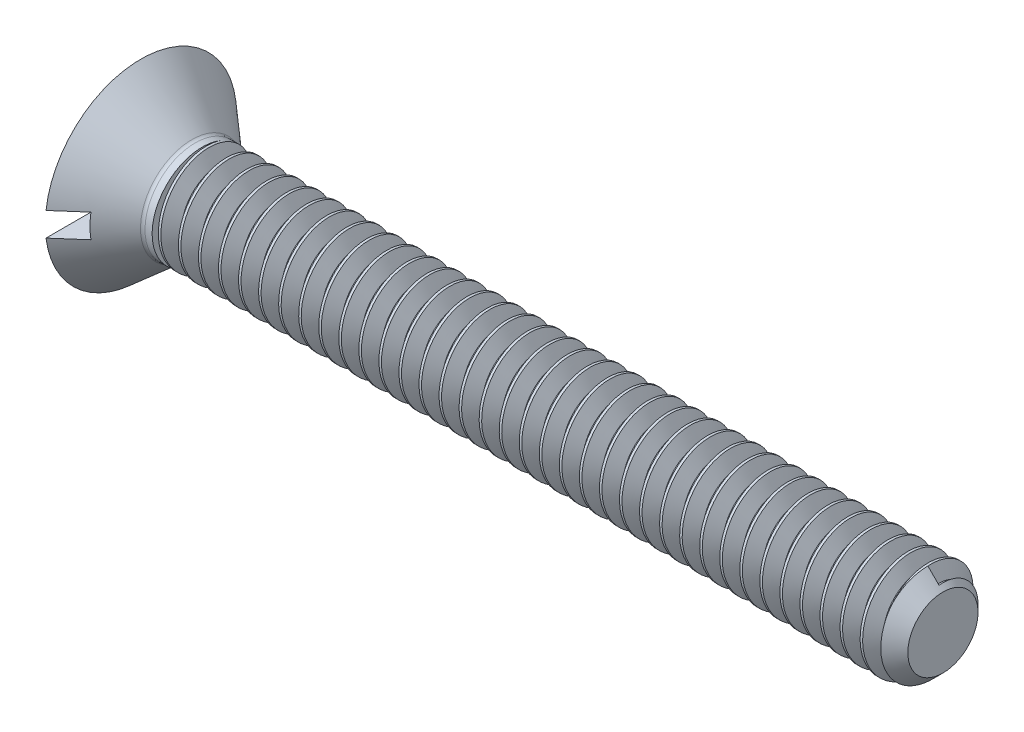
from build123d import *

# Parameters (mm, degrees)
CUT_EXTRUDE1_DEPTH      = 27.80590056
CUT_EXTRUDE1_DEPTH_BACK = 27.80590056
SKETCH3_W               = 1.514475
SKETCH3_H               = 1.514475
FILLET1_R               = 0.3175
CHAMFER1_SIZE           = 0.9525
CUT_SWEEP1_PITCH        = 1.27
CUT_SWEEP1_TO           = 46.9138


with BuildPart() as part:
    # Sketch2 → Revolve1 (revolve)
    with BuildSketch(Plane.XY, mode=Mode.PRIVATE) as revolve1_sk:
        Polygon((-25.4, 0), (25.4, 0), (25.4, 3.175), (-21.5138, 3.175), (-22.083602919, 3.175), (-25.4, 6.0579), align=None)
    revolve(revolve1_sk.sketch.rotate(Axis((-25.4, 0, 0), (1, 0, 0)), 180), axis=Axis((-25.4, 0, 0), (1, 0, 0)))

    # Sketch3 → Cut-Extrude1 (cut, two sides: drawn at the far end of the back side and taken through both)
    with BuildSketch(Plane.XY.offset(-CUT_EXTRUDE1_DEPTH_BACK)):
        with Locations((-24.6427625, 0)):
            Rectangle(SKETCH3_W, SKETCH3_H)
    extrude(amount=CUT_EXTRUDE1_DEPTH + CUT_EXTRUDE1_DEPTH_BACK, mode=Mode.SUBTRACT)

    # Fillet1
    fillet1_edges = [part.edges().sort_by_distance(p)[0] for p in [
        (-22.083602919, 3.175, 0),
    ]]
    fillet(fillet1_edges, radius=FILLET1_R)


with BuildPart() as body_2:
    # Split1: the piece on the far side of the plane
    add(part.part)
    split(bisect_by=Plane(origin=(-21.5138, 0, 0), x_dir=(0, 0, 1), z_dir=(1, 0, 0)), keep=Keep.BOTTOM)


with BuildPart() as part_1:
    add(part.part)

    # Split1
    split(bisect_by=Plane(origin=(-21.5138, 0, 0), x_dir=(0, 0, 1), z_dir=(1, 0, 0)), keep=Keep.TOP)

    # Chamfer1
    chamfer1_edges = [part_1.edges().sort_by_distance(p)[0] for p in [
        (25.4, 3.175, 0),
    ]]
    chamfer(chamfer1_edges, length=CHAMFER1_SIZE)

    # Cut-Sweep1: arcs per turn and ends read off the stored shape
    # Cut-Sweep1: the profile of Sketch5 profile screwed along a right-hand helix through 37.5 turns, 8 arcs to a turn; built about Z, then put on its axis
    cut_sweep1_z = Axis((0, 0, 0), (0, 0, 1))
    cut_sweep1_corners = [(3.1753, 0, 0.952673205), (3.1753, 0, -0.158923205), (2.350110803, 0, 0.3175), (2.350110803, 0, 0.47625)]
    with BuildLine(mode=Mode.PRIVATE) as cut_sweep1_profile:
        Line(cut_sweep1_corners[0], cut_sweep1_corners[1])
        Line(cut_sweep1_corners[1], cut_sweep1_corners[2])
        Line(cut_sweep1_corners[2], cut_sweep1_corners[3])
        Line(cut_sweep1_corners[3], cut_sweep1_corners[0])
    cut_sweep1_cap = Face(cut_sweep1_profile.wire())
    cut_sweep1_turn_angles = [0, 22.5, 45, 67.5, 90, 112.5, 135, 157.5, 180, 202.5, 225, 247.5, 270, 292.5, 315, 337.5, 360]
    cut_sweep1_turn_weights = [1, 0.9238795325112867, 1, 0.9238795325112867, 1, 0.9238795325112867, 1, 0.9238795325112867, 1, 0.9238795325112867, 1, 0.9238795325112867, 1, 0.9238795325112867, 1, 0.9238795325112867, 1]
    cut_sweep1_turn_rails = [Edge.make_bspline([Vector(p[0], p[1], 0).rotate(cut_sweep1_z, cut_sweep1_turn_angles[k]) / cut_sweep1_turn_weights[k] + Vector(0, 0, p[2] + CUT_SWEEP1_PITCH * cut_sweep1_turn_angles[k] / 360) for k in range(17)], [0, 0, 0, 1, 1, 2, 2, 3, 3, 4, 4, 5, 5, 6, 6, 7, 7, 8, 8, 8], 2, cut_sweep1_turn_weights) for p in cut_sweep1_corners]
    cut_sweep1_turn_sides = [Face.make_surface_from_curves(cut_sweep1_turn_rails[p[0]], cut_sweep1_turn_rails[p[1]]) for p in [(0, 1), (1, 2), (2, 3), (3, 0)]]
    cut_sweep1_last_angles = [13320, 13342.5, 13365, 13387.5, 13410, 13432.5, 13455, 13477.5, 13500]
    cut_sweep1_last_weights = [1, 0.9238795325112867, 1, 0.9238795325112867, 1, 0.9238795325112867, 1, 0.9238795325112867, 1]
    cut_sweep1_last_rails = [Edge.make_bspline([Vector(p[0], p[1], 0).rotate(cut_sweep1_z, cut_sweep1_last_angles[k]) / cut_sweep1_last_weights[k] + Vector(0, 0, p[2] + CUT_SWEEP1_PITCH * cut_sweep1_last_angles[k] / 360) for k in range(9)], [0, 0, 0, 1, 1, 2, 2, 3, 3, 4, 4, 4], 2, cut_sweep1_last_weights) for p in cut_sweep1_corners]
    cut_sweep1_last_sides = [Face.make_surface_from_curves(cut_sweep1_last_rails[p[0]], cut_sweep1_last_rails[p[1]]) for p in [(0, 1), (1, 2), (2, 3), (3, 0)]]
    cut_sweep1 = Plane(origin=(25.4, 0, 0), x_dir=(0, 1, 0), z_dir=(-1, 0, 0)) * split(Solid(Shell([*[p.moved(Location((0, 0, CUT_SWEEP1_PITCH * i))) for i in range(37) for p in cut_sweep1_turn_sides], *cut_sweep1_last_sides, cut_sweep1_cap, cut_sweep1_cap.rotate(cut_sweep1_z, 13500).moved(Location((0, 0, CUT_SWEEP1_PITCH * 13500 / 360)))])), bisect_by=Plane.XY.offset(CUT_SWEEP1_TO), keep=Keep.BOTTOM, mode=Mode.PRIVATE)
    add(cut_sweep1, mode=Mode.SUBTRACT)

    # Combine1: union body 2
    add(body_2.part)


solid = part_1.part
